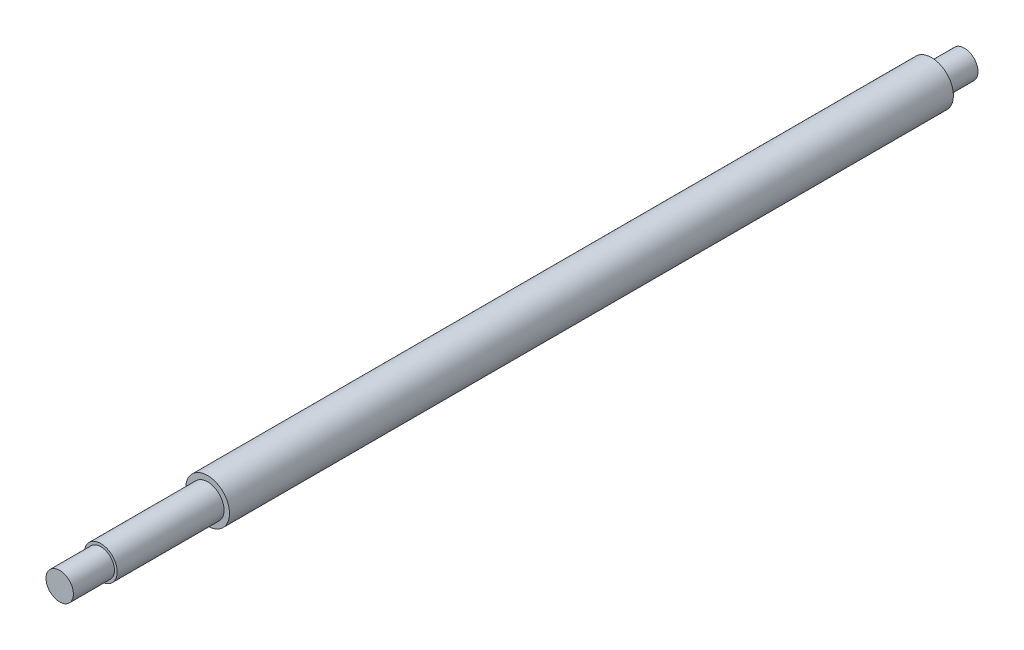
from build123d import *


with BuildPart() as part:
    # Sketch1 → Revolve1 (revolve)
    with BuildSketch(Plane(origin=(0, 0, 0), x_dir=(0, 0, -1), z_dir=(1, 0, 0))):
        Polygon((-318.98, 0), (-318.98, 5), (-303.98, 5), (-303.98, 6), (-264.98, 6), (-264.98, 8), (-0.68, 8), (-0.68, 5), (11.32, 5), (11.32, 0), align=None)
    revolve(axis=Axis((0, 0, 0), (0, 0, 1)))


solid = part.part
